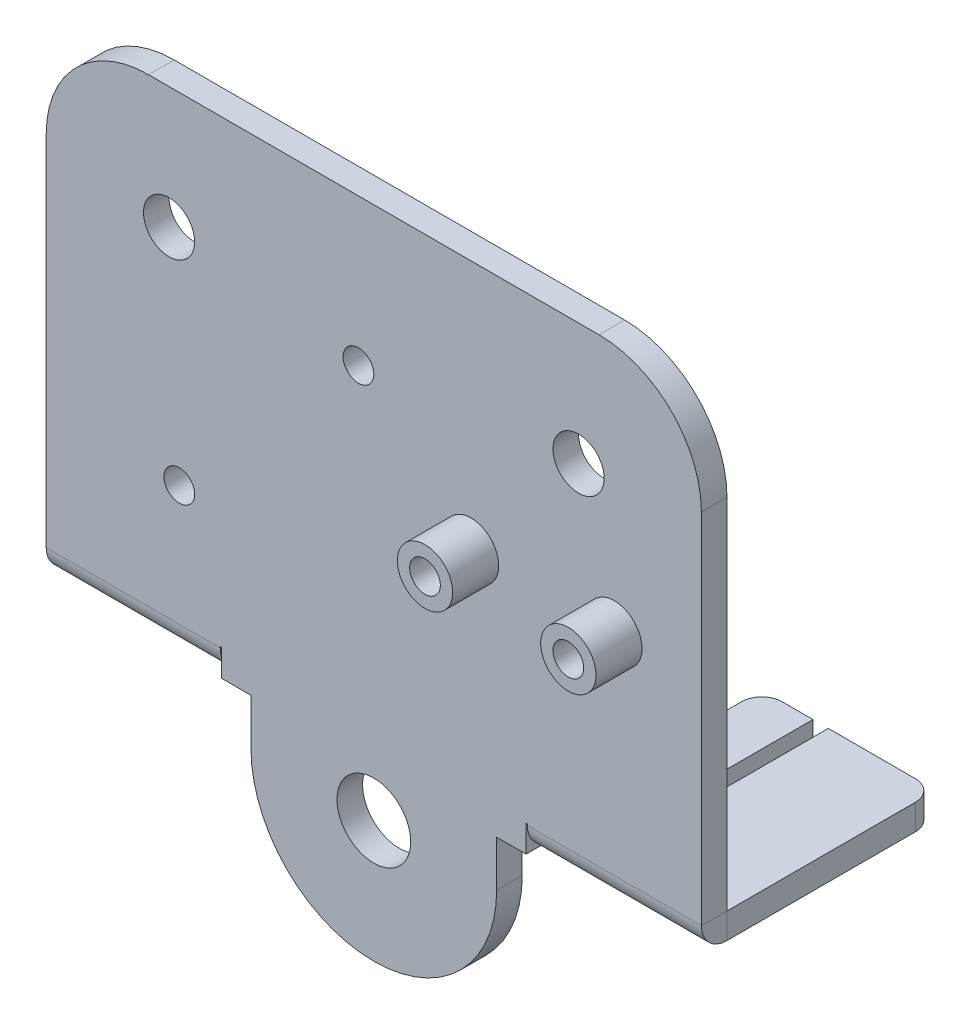
from build123d import *

# Parameters (mm, degrees)
BRIDA_BASE1_DEPTH                   = 2.5
CROQUIS16_W                         = 1.5
CROQUIS16_H                         = 11
CORTAR_EXTRUIR1_DEPTH               = 48.758002549
CROQUIS17_W                         = 1.5
CROQUIS17_H                         = 11
CORTAR_EXTRUIR2_DEPTH               = 48.758002549
CROQUIS18_R                         = 2
SALIENTE_EXTRUIR1_DEPTH             = 1.5
CROQUIS19_R                         = 2.7
SALIENTE_EXTRUIR2_DEPTH             = 4.5
CROQUIS20_R                         = 2.7
SALIENTE_EXTRUIR3_DEPTH             = 4.5
CROQUIS21_R                         = 2
SALIENTE_EXTRUIR4_DEPTH             = 1.5
DI_METRO_DE_TALADRO_3_0_3_1_D       = 3
DI_METRO_DE_TALADRO_3_0_3_2_D       = 3
DI_METRO_DE_TALADRO_3_0_3_2_DEPTH   = 8.5
DI_METRO_DE_TALADRO_7_2_7_2_1_D     = 7.2
DI_METRO_DE_TALADRO_7_2_7_2_1_DEPTH = 4
DI_METRO_DE_TALADRO_3_0_3_3_D       = 3
DI_METRO_DE_TALADRO_3_0_3_3_DEPTH   = 8.5
DI_METRO_DE_TALADRO_5_0_5_1_D       = 5
DI_METRO_DE_TALADRO_5_0_5_1_DEPTH   = 7
PLIEGUE_START                       = -35.363495408
PLIEGUE_CROQUIZADO1_OUTLINE_W       = 17
PLIEGUE_CROQUIZADO1_OUTLINE_H       = 2.5
PLIEGUE_CROQUIZADO1_DEPTH           = 19.863495408
PLIEGUE_START_2                     = -15.5
PLIEGUE_CROQUIZADO1_2_DEPTH         = 2.5
PLIEGUE_START_3                     = 15
PLIEGUE_CROQUIZADO1_3_DEPTH         = 18
PLIEGUE_CROQUIZADO2_OUTLINE_W       = 17
PLIEGUE_CROQUIZADO2_OUTLINE_H       = 2.5
PLIEGUE_CROQUIZADO2_DEPTH           = 19.863495408
PLIEGUE_CROQUIZADO2_2_DEPTH         = 2.5
PLIEGUE_START_4                     = -33
PLIEGUE_CROQUIZADO2_3_DEPTH         = 18


with BuildPart() as part:
    # Brida base1: sheet metal written as solids
    # Croquis11 → Brida base1 (new body)
    with BuildSketch(Plane.XY.offset(2.5)):
        with BuildLine():
            Line((-30, -35.363495408), (-17, -35.363495408))
            ThreePointArc((-17, -35.363495408), (-15.585786438, -34.777708971), (-15, -33.363495408))
            Line((-15, -33.363495408), (-15, -12.875))
            Line((-15, -12.875), (-14.875, -12.875))
            Line((-14.875, -12.875), (-14.875, -15.5))
            Line((-14.875, -15.5), (-12, -15.5))
            Line((-12, -15.5), (-12, -20))
            ThreePointArc((-12, -20), (0, -32), (12, -20))
            Line((12, -20), (12, -15.5))
            Line((12, -15.5), (14.875, -15.5))
            Line((14.875, -15.5), (14.875, -12.875))
            Line((14.875, -12.875), (15, -12.875))
            Line((15, -12.875), (15, -33.363495408))
            ThreePointArc((15, -33.363495408), (15.585786438, -34.777708971), (17, -35.363495408))
            Line((17, -35.363495408), (30, -35.363495408))
            ThreePointArc((30, -35.363495408), (31.414213562, -34.777708971), (32, -33.363495408))
            Line((32, -33.363495408), (32, 22))
            ThreePointArc((32, 22), (29.071067812, 29.071067812), (22, 32))
            Line((22, 32), (-22, 32))
            ThreePointArc((-22, 32), (-29.071067812, 29.071067812), (-32, 22))
            Line((-32, 22), (-32, -33.363495408))
            ThreePointArc((-32, -33.363495408), (-31.414213562, -34.777708971), (-30, -35.363495408))
        make_face()
    extrude(amount=-BRIDA_BASE1_DEPTH)

    # Croquis16 → Cortar-Extruir1 (cut, through all)
    with BuildSketch(Plane.XY.offset(2.5)):
        with Locations((-20.75, -29.863495408)):
            Rectangle(CROQUIS16_W, CROQUIS16_H)
    extrude(amount=-CORTAR_EXTRUIR1_DEPTH, mode=Mode.SUBTRACT)

    # Croquis17 → Cortar-Extruir2 (cut, through all)
    with BuildSketch(Plane(origin=(0, 0, 0), x_dir=(-1, 0, 0), z_dir=(0, 0, -1))):
        with Locations((-20.75, -29.863495408)):
            Rectangle(CROQUIS17_W, CROQUIS17_H)
    extrude(amount=-CORTAR_EXTRUIR2_DEPTH, mode=Mode.SUBTRACT)

    # Croquis18 → Saliente-Extruir1 (add)
    with BuildSketch(Plane(origin=(0, 0, 0), x_dir=(-1, 0, 0), z_dir=(0, 0, -1))):
        with Locations(Location((1.5, 17.65, 0), (0, 0, 180))):
            Circle(CROQUIS18_R)
    extrude(amount=SALIENTE_EXTRUIR1_DEPTH)

    # Croquis19 → Saliente-Extruir2 (add)
    with BuildSketch(Plane.XY.offset(2.5)):
        with Locations((23.5, 7.55)):
            Circle(CROQUIS19_R)
    extrude(amount=SALIENTE_EXTRUIR2_DEPTH)

    # Croquis20 → Saliente-Extruir3 (add)
    with BuildSketch(Plane.XY.offset(2.5)):
        with Locations((9.5, 7.55)):
            Circle(CROQUIS20_R)
    extrude(amount=SALIENTE_EXTRUIR3_DEPTH)

    # Croquis21 → Saliente-Extruir4 (add)
    with BuildSketch(Plane(origin=(0, 0, 0), x_dir=(-1, 0, 0), z_dir=(0, 0, -1))):
        with Locations(Location((19, -1.25, 0), (0, 0, 180))):
            Circle(CROQUIS21_R)
    extrude(amount=SALIENTE_EXTRUIR4_DEPTH)

    # Diámetro de taladro Ø3.0 (3)1 (through all)
    with Locations(Plane.XY.offset(2.5)):
        with Locations((-19, -1.25)):
            Hole(DI_METRO_DE_TALADRO_3_0_3_1_D / 2)

    # Diámetro de taladro Ø3.0 (3)2
    with Locations(Plane.XY.offset(7)):
        with Locations((23.5, 7.55), (9.5, 7.55)):
            Hole(DI_METRO_DE_TALADRO_3_0_3_2_D / 2, depth=DI_METRO_DE_TALADRO_3_0_3_2_DEPTH)

    # Diámetro de taladro Ø7.2 (7.2)1
    with Locations(Plane.XY.offset(2.5)):
        with Locations((0, -20.1)):
            Hole(DI_METRO_DE_TALADRO_7_2_7_2_1_D / 2, depth=DI_METRO_DE_TALADRO_7_2_7_2_1_DEPTH)

    # Diámetro de taladro Ø3.0 (3)3
    with Locations(Plane(origin=(0, 0, -1.5), x_dir=(-1, 0, 0), z_dir=(0, 0, -1))):
        with Locations((1.5, 17.65)):
            Hole(DI_METRO_DE_TALADRO_3_0_3_3_D / 2, depth=DI_METRO_DE_TALADRO_3_0_3_3_DEPTH)

    # Diámetro de taladro Ø5.0 (5)1
    with Locations(Plane(origin=(0, 0, 0), x_dir=(-1, 0, 0), z_dir=(0, 0, -1))):
        with Locations((20, 20.1), (-20, 20.1)):
            Hole(DI_METRO_DE_TALADRO_5_0_5_1_D / 2, depth=DI_METRO_DE_TALADRO_5_0_5_1_DEPTH)

    # Pliegue croquizado1: read off the stored shape, not the designer's step
    # Pliegue croquizado1 outline → Pliegue croquizado1 (cut)
    with BuildSketch(Plane(origin=(0, 0, 0), x_dir=(1, 0, 0), z_dir=(0, 1, 0)).offset(PLIEGUE_START)):
        with Locations((23.5, -1.25)):
            Rectangle(PLIEGUE_CROQUIZADO1_OUTLINE_W, PLIEGUE_CROQUIZADO1_OUTLINE_H)
    extrude(amount=PLIEGUE_CROQUIZADO1_DEPTH, mode=Mode.SUBTRACT)

    # Pliegue croquizado1 2 outline → Pliegue croquizado1 2 (add)
    with BuildSketch(Plane(origin=(0, 0, 0), x_dir=(1, 0, 0), z_dir=(0, 1, 0)).offset(PLIEGUE_START_2)):
        with BuildLine():
            Line((15, 0), (32, 0))
            Line((32, 0), (32, 18.4))
            ThreePointArc((32, 18.4), (31.414213562, 19.814213562), (30, 20.4))
            Line((30, 20.4), (21.5, 20.4))
            Line((21.5, 20.4), (21.5, 9.4))
            Line((21.5, 9.4), (20, 9.4))
            Line((20, 9.4), (20, 20.4))
            Line((20, 20.4), (17, 20.4))
            ThreePointArc((17, 20.4), (15.585786438, 19.814213562), (15, 18.4))
            Line((15, 18.4), (15, 0))
        make_face()
    extrude(amount=PLIEGUE_CROQUIZADO1_2_DEPTH)

    # Pliegue croquizado1 3 outline → Pliegue croquizado1 3 (cut)
    with BuildSketch(Plane.YZ.offset(PLIEGUE_START_3)):
        with BuildLine():
            Line((-15.5, 2.5), (-15.5, 0))
            ThreePointArc((-15.5, 0), (-14.767766953, 1.767766953), (-13, 2.5))
            Line((-13, 2.5), (-15.5, 2.5))
        make_face()
    extrude(amount=PLIEGUE_CROQUIZADO1_3_DEPTH, mode=Mode.SUBTRACT)

    # Pliegue croquizado2: read off the stored shape, not the designer's step
    # Pliegue croquizado2 outline → Pliegue croquizado2 (cut)
    with BuildSketch(Plane(origin=(0, 0, 0), x_dir=(1, 0, 0), z_dir=(0, 1, 0)).offset(PLIEGUE_START)):
        with Locations((-23.5, -1.25)):
            Rectangle(PLIEGUE_CROQUIZADO2_OUTLINE_W, PLIEGUE_CROQUIZADO2_OUTLINE_H)
    extrude(amount=PLIEGUE_CROQUIZADO2_DEPTH, mode=Mode.SUBTRACT)

    # Pliegue croquizado2 2 outline → Pliegue croquizado2 2 (add)
    with BuildSketch(Plane(origin=(0, 0, 0), x_dir=(1, 0, 0), z_dir=(0, 1, 0)).offset(PLIEGUE_START_2)):
        with BuildLine():
            ThreePointArc((-30, 20.4), (-31.414213562, 19.814213562), (-32, 18.4))
            Line((-32, 18.4), (-32, 0))
            Line((-32, 0), (-15, 0))
            Line((-15, 0), (-15, 18.4))
            ThreePointArc((-15, 18.4), (-15.585786438, 19.814213562), (-17, 20.4))
            Line((-17, 20.4), (-20, 20.4))
            Line((-20, 20.4), (-20, 9.4))
            Line((-20, 9.4), (-21.5, 9.4))
            Line((-21.5, 9.4), (-21.5, 20.4))
            Line((-21.5, 20.4), (-30, 20.4))
        make_face()
    extrude(amount=PLIEGUE_CROQUIZADO2_2_DEPTH)

    # Pliegue croquizado2 3 outline → Pliegue croquizado2 3 (cut)
    with BuildSketch(Plane.YZ.offset(PLIEGUE_START_4)):
        with BuildLine():
            Line((-15.5, 2.5), (-15.5, 0))
            ThreePointArc((-15.5, 0), (-14.767766953, 1.767766953), (-13, 2.5))
            Line((-13, 2.5), (-15.5, 2.5))
        make_face()
    extrude(amount=PLIEGUE_CROQUIZADO2_3_DEPTH, mode=Mode.SUBTRACT)


solid = part.part
